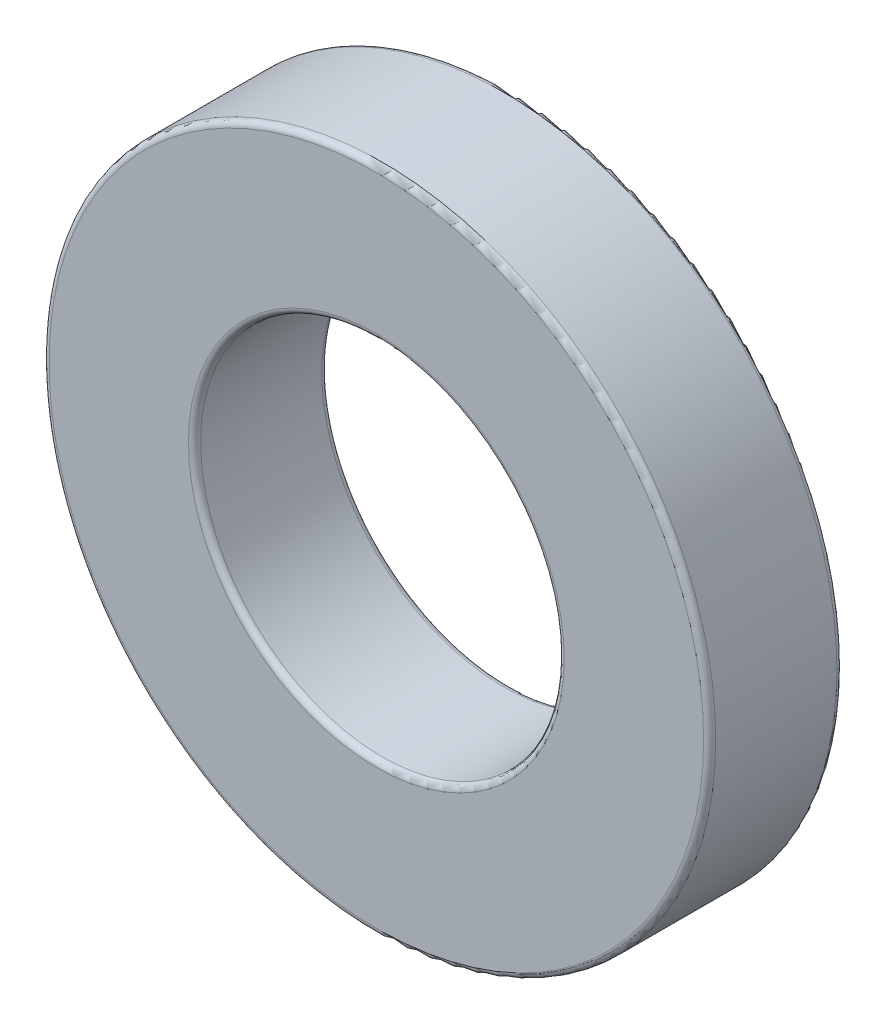
from build123d import *

# Parameters (mm, degrees)
IZIM1_R                     = 55
IZIM1_R_2                   = 30
Y_KSEKLIK_EKSTR_ZYON1_DEPTH = 22
RADYUS1_R                   = 1


with BuildPart() as part:
    # Çizim1 → Yükseklik-Ekstrüzyon1 (new body)
    with BuildSketch(Plane.XY):
        Circle(IZIM1_R)
        Circle(IZIM1_R_2, mode=Mode.SUBTRACT)
    extrude(amount=Y_KSEKLIK_EKSTR_ZYON1_DEPTH)

    # Radyus1
    radyus1_edges = [part.edges().sort_by_distance(p)[0] for p in [
        (-55, 0, 0),
        (-30, 0, 0),
        (-30, 0, 22),
        (-55, 0, 22),
    ]]
    fillet(radyus1_edges, radius=RADYUS1_R)


solid = part.part
